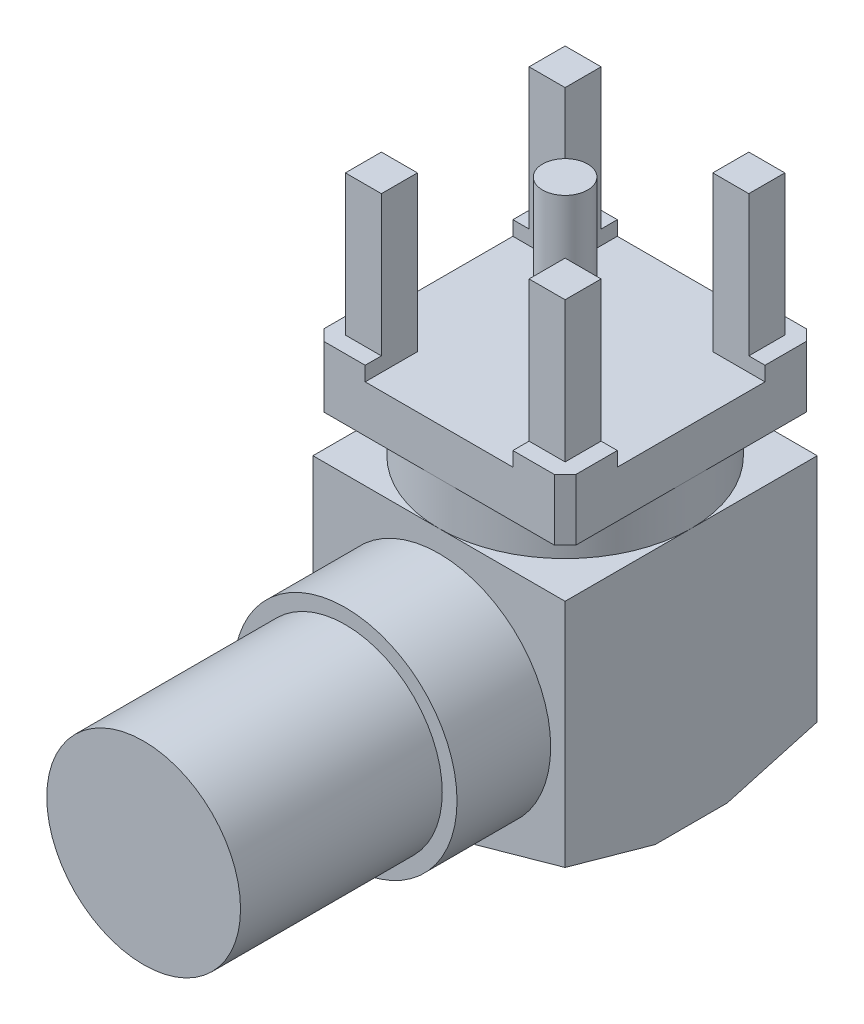
from build123d import *

# Parameters (mm, degrees)
SKETCH1_W           = 7
SKETCH1_H           = 7
BOSS_EXTRUDE1_DEPTH = 1.3
SKETCH2_W           = 1.45
SKETCH2_H           = 1.45
BOSS_EXTRUDE2_DEPTH = 0.4
SKETCH3_W           = 1
SKETCH3_H           = 1
BOSS_EXTRUDE3_DEPTH = 3.9
SKETCH4_R           = 0.625
BOSS_EXTRUDE4_DEPTH = 4.2
SKETCH5_R           = 3.5
BOSS_EXTRUDE5_DEPTH = 1.2
SKETCH6_W           = 7
SKETCH6_H           = 7
BOSS_EXTRUDE6_DEPTH = 7.1
CHAMFER1_START      = 8.88850564
CHAMFER1_OUTLINE_W  = 6
CHAMFER1_OUTLINE_H  = 6
CHAMFER1_DEPTH      = 2.11149436
CHAMFER2_START      = -11
CHAMFER2_OUTLINE_W  = 6
CHAMFER2_OUTLINE_H  = 6
CHAMFER2_DEPTH      = 2.11149436
CHAMFER3_START      = 8.88850564
CHAMFER3_OUTLINE_W  = 6
CHAMFER3_OUTLINE_H  = 6
CHAMFER3_DEPTH      = 2.11149436
CHAMFER4_START      = -11
CHAMFER4_OUTLINE_W  = 6
CHAMFER4_OUTLINE_H  = 6
CHAMFER4_DEPTH      = 2.11149436
CHAMFER5_SIZE       = 0.3
SKETCH7_R           = 3.1
BOSS_EXTRUDE7_DEPTH = 2.6
SKETCH8_R           = 2.68986
BOSS_EXTRUDE8_DEPTH = 5.6


with BuildPart() as part:
    # Sketch1 → Boss-Extrude1 (new body)
    with BuildSketch(Plane(origin=(0, 0, 0), x_dir=(1, 0, 0), z_dir=(0, 1, 0))):
        Rectangle(SKETCH1_W, SKETCH1_H)
    extrude(amount=BOSS_EXTRUDE1_DEPTH)

    # Sketch2 → Boss-Extrude2 (add)
    with BuildSketch(Plane(origin=(0, 1.3, 0), x_dir=(1, 0, 0), z_dir=(0, 1, 0))):
        with Locations((-2.775, 2.775)):
            Rectangle(SKETCH2_W, SKETCH2_H)
        with Locations((2.775, 2.775)):
            Rectangle(SKETCH2_W, SKETCH2_H)
        with Locations((2.775, -2.775)):
            Rectangle(SKETCH2_W, SKETCH2_H)
        with Locations((-2.775, -2.775)):
            Rectangle(SKETCH2_W, SKETCH2_H)
    extrude(amount=BOSS_EXTRUDE2_DEPTH)

    # Sketch3 → Boss-Extrude3 (add)
    with BuildSketch(Plane(origin=(0, 1.7, 0), x_dir=(1, 0, 0), z_dir=(0, 1, 0))):
        with Locations((-2.55, 2.55)):
            Rectangle(SKETCH3_W, SKETCH3_H)
        with Locations((-2.55, -2.55)):
            Rectangle(SKETCH3_W, SKETCH3_H)
        with Locations((2.55, -2.55)):
            Rectangle(SKETCH3_W, SKETCH3_H)
        with Locations((2.55, 2.55)):
            Rectangle(SKETCH3_W, SKETCH3_H)
    extrude(amount=BOSS_EXTRUDE3_DEPTH)

    # Sketch4 → Boss-Extrude4 (add)
    with BuildSketch(Plane(origin=(0, 1.3, 0), x_dir=(1, 0, 0), z_dir=(0, 1, 0))):
        with Locations(Location((0, 0, 0), (0, 0, 270))):
            Circle(SKETCH4_R)
    extrude(amount=BOSS_EXTRUDE4_DEPTH)

    # Sketch5 → Boss-Extrude5 (add)
    with BuildSketch(Plane(origin=(0, 0, 0), x_dir=(-1, 0, 0), z_dir=(0, -1, 0))):
        with Locations(Location((0, 0, 0), (0, 0, 90))):
            Circle(SKETCH5_R)
    extrude(amount=BOSS_EXTRUDE5_DEPTH)

    # Sketch6 → Boss-Extrude6 (add)
    with BuildSketch(Plane(origin=(0, -1.2, 0), x_dir=(-1, 0, 0), z_dir=(0, -1, 0))):
        Rectangle(SKETCH6_W, SKETCH6_H)
    extrude(amount=BOSS_EXTRUDE6_DEPTH)

    # Chamfer1: read off the stored shape, not the designer's step
    # Chamfer1 outline → Chamfer1 (cut)
    with BuildSketch(Plane(origin=(0, 0, 0), x_dir=(0.9655189447347837, 0.25069112066556, 0.07019351378635694), z_dir=(0.26033280115696106, -0.9297600041320021, -0.26033280115696106)).offset(CHAMFER1_START)):
        Rectangle(CHAMFER1_OUTLINE_W, CHAMFER1_OUTLINE_H)
    extrude(amount=CHAMFER1_DEPTH, mode=Mode.SUBTRACT)

    # Chamfer2: read off the stored shape, not the designer's step
    # Chamfer2 outline → Chamfer2 (cut)
    with BuildSketch(Plane(origin=(0, 0, 0), x_dir=(0.9655189447347837, -0.25069112066556, -0.07019351378635694), z_dir=(0.26033280115696106, 0.9297600041320021, 0.26033280115696106)).offset(CHAMFER2_START)):
        Rectangle(CHAMFER2_OUTLINE_W, CHAMFER2_OUTLINE_H)
    extrude(amount=CHAMFER2_DEPTH, mode=Mode.SUBTRACT)

    # Chamfer3: read off the stored shape, not the designer's step
    # Chamfer3 outline → Chamfer3 (cut)
    with BuildSketch(Plane(origin=(0, 0, 0), x_dir=(0.9655189447347837, 0.25069112066556, -0.07019351378635694), z_dir=(0.26033280115696106, -0.9297600041320021, 0.26033280115696106)).offset(CHAMFER3_START)):
        Rectangle(CHAMFER3_OUTLINE_W, CHAMFER3_OUTLINE_H)
    extrude(amount=CHAMFER3_DEPTH, mode=Mode.SUBTRACT)

    # Chamfer4: read off the stored shape, not the designer's step
    # Chamfer4 outline → Chamfer4 (cut)
    with BuildSketch(Plane(origin=(0, 0, 0), x_dir=(0.9655189447347837, -0.25069112066556, 0.07019351378635694), z_dir=(0.26033280115696106, 0.9297600041320021, -0.26033280115696106)).offset(CHAMFER4_START)):
        Rectangle(CHAMFER4_OUTLINE_W, CHAMFER4_OUTLINE_H)
    extrude(amount=CHAMFER4_DEPTH, mode=Mode.SUBTRACT)

    # Chamfer5
    chamfer5_edges = [part.edges().sort_by_distance(p)[0] for p in [
        (3.5, 0.85, 3.5),
        (-3.5, 0.85, 3.5),
        (-3.5, 0.85, -3.5),
        (3.5, 0.85, -3.5),
    ]]
    chamfer(chamfer5_edges, length=CHAMFER5_SIZE)

    # Sketch7 → Boss-Extrude7 (add)
    with BuildSketch(Plane.XY.offset(3.5)):
        with Locations(Location((0, -4.9, 0), (0, 0, 180))):
            Circle(SKETCH7_R)
    extrude(amount=BOSS_EXTRUDE7_DEPTH)

    # Sketch8 → Boss-Extrude8 (add)
    with BuildSketch(Plane.XY.offset(6.1)):
        with Locations((0, -4.9)):
            Circle(SKETCH8_R)
    extrude(amount=BOSS_EXTRUDE8_DEPTH)


solid = part.part
